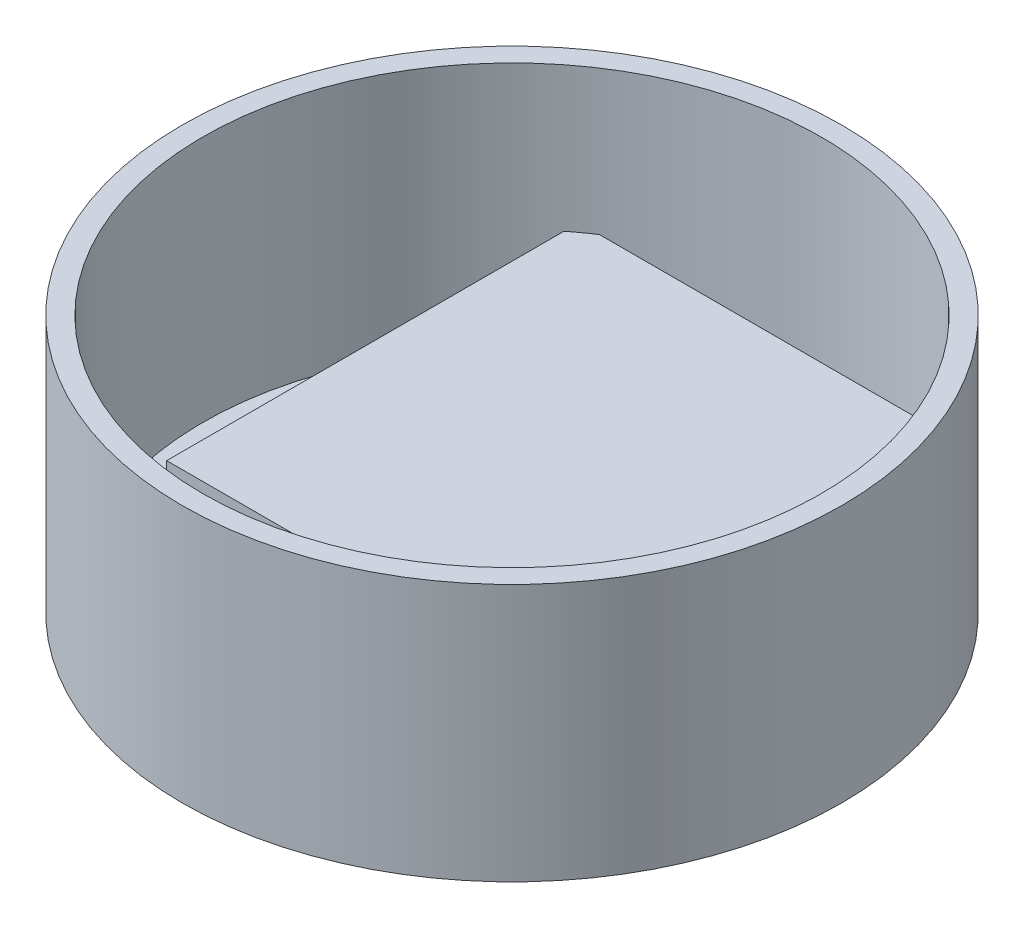
from build123d import *

# Parameters (mm, degrees)
SKETCH2_R           = 32
BOSS_EXTRUDE1_DEPTH = 25
SKETCH3_R           = 30
CUT_EXTRUDE1_DEPTH  = 24
BOSS_EXTRUDE2_START = 10
BOSS_EXTRUDE2_DEPTH = 10


with BuildPart() as part:
    # Sketch2 → Boss-Extrude1 (new body)
    with BuildSketch(Plane(origin=(0, 0, 0), x_dir=(1, 0, 0), z_dir=(0, 1, 0))):
        Circle(SKETCH2_R)
    extrude(amount=BOSS_EXTRUDE1_DEPTH)

    # Sketch3 → Cut-Extrude1 (cut)
    with BuildSketch(Plane(origin=(0, 25, 0), x_dir=(1, 0, 0), z_dir=(0, 1, 0))):
        Circle(SKETCH3_R)
    extrude(amount=-CUT_EXTRUDE1_DEPTH, mode=Mode.SUBTRACT)

    # Sketch4 → Boss-Extrude2 (add)
    with BuildSketch(Plane(origin=(0, 1, 0), x_dir=(1, 0, 0), z_dir=(0, 1, 0)).offset(BOSS_EXTRUDE2_START)):
        with BuildLine():
            Line((-18.541196676, -14.972239163), (18.541196676, -14.975032814))
            Line((18.541196676, -14.975032814), (18.541196676, 23.584402172))
            ThreePointArc((18.541196676, 23.584402172), (17.556036053, 24.32664379), (16.541196676, 25.027760837))
            Line((16.541196676, 25.027760837), (-16.541196676, 25.027760837))
            ThreePointArc((-16.541196676, 25.027760837), (-17.556036053, 24.32664379), (-18.541196676, 23.584402172))
            Line((-18.541196676, 23.584402172), (-18.541196676, -14.972239163))
        make_face()
    extrude(amount=-BOSS_EXTRUDE2_DEPTH)


solid = part.part
